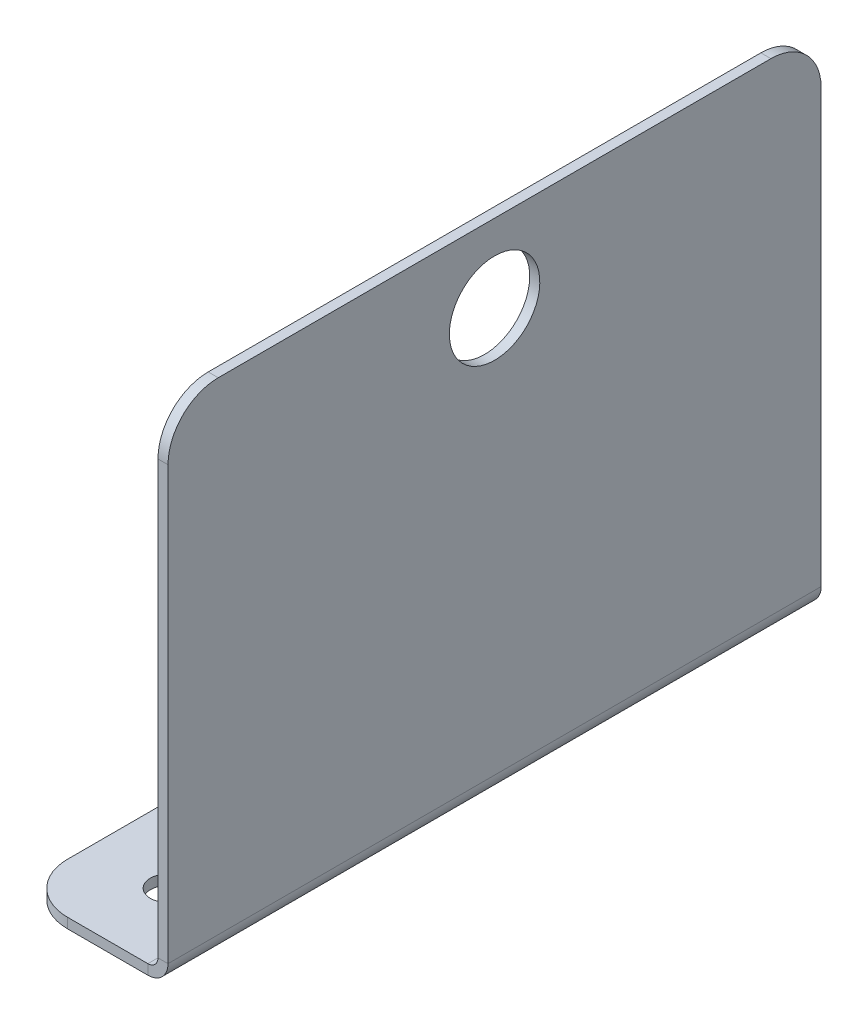
from build123d import *

# Parameters (mm, degrees)
BASE_FLANGE1_DEPTH = 130
FILLET1_R          = 10
SKETCH6_R          = 3.5
CUT_EXTRUDE1_DEPTH = 10
SKETCH7_R          = 9
CUT_EXTRUDE2_DEPTH = 2


# Sheet-metal steps are written as plain solids
with BuildPart() as part:
    # Sketch1 → Base-Flange1 (new body)
    with BuildSketch(Plane.XY):
        with BuildLine():
            Line((0, 100), (0, 4))
            ThreePointArc((0, 4), (-1.171572875, 1.171572875), (-4, 0))
            Line((-4, 0), (-30, 0))
            Line((-30, 0), (-30, 2))
            Line((-30, 2), (-4, 2))
            ThreePointArc((-4, 2), (-2.585786438, 2.585786438), (-2, 4))
            Line((-2, 4), (-2, 100))
            Line((-2, 100), (0, 100))
        make_face()
    extrude(amount=BASE_FLANGE1_DEPTH)

    # Fillet1
    fillet1_edges = [part.edges().sort_by_distance(p)[0] for p in [
        (-1, 100, 130),
        (-1, 100, 0),
        (-30, 1, 130),
        (-30, 1, 0),
    ]]
    fillet(fillet1_edges, radius=FILLET1_R)

    # Sketch6 → Cut-Extrude1 (cut)
    with BuildSketch(Plane(origin=(0, 2, 0), x_dir=(1, 0, 0), z_dir=(0, 1, 0))):
        with Locations(Location((-15, -15, 0), (0, 0, 270))):
            Circle(SKETCH6_R)
        with Locations(Location((-15, -115, 0), (0, 0, 270))):
            Circle(SKETCH6_R)
    extrude(amount=-CUT_EXTRUDE1_DEPTH, mode=Mode.SUBTRACT)

    # Sketch7 → Cut-Extrude2 (cut)
    with BuildSketch(Plane(origin=(0, 0, 0), x_dir=(0, 0, -1), z_dir=(1, 0, 0))):
        with Locations(Location((-65, 84.499999997, 0), (0, 0, 90))):
            Circle(SKETCH7_R)
    extrude(amount=-CUT_EXTRUDE2_DEPTH, mode=Mode.SUBTRACT)


solid = part.part
